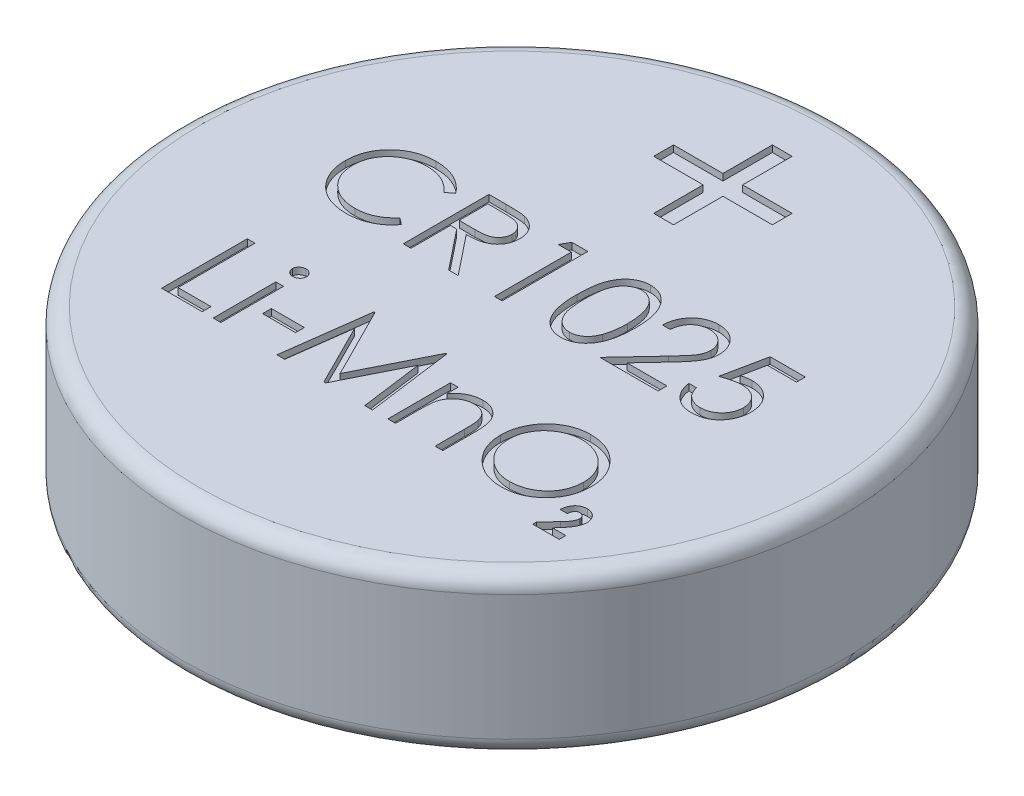
from build123d import *

# Parameters (mm, degrees)
BOSS_EXTRUDE1_START = 0.1
SKETCH1_R           = 5
BOSS_EXTRUDE1_DEPTH = 2.4
BOSS_EXTRUDE2_REACH = 9.5
SKETCH2_R           = 4
FILLET1_R           = 0.25
FILLET2_R           = 0.1
SKETCH3_W           = 0.116666667
SKETCH3_H           = 0.95
SKETCH3_W_2         = 0.5
SKETCH3_H_2         = 0.133333333
CUT_EXTRUDE1_DEPTH  = 0.1
CUT_EXTRUDE2_DEPTH  = 0.1


with BuildPart() as part:
    # Sketch1 → Boss-Extrude1 (new body)
    with BuildSketch(Plane(origin=(0, 0, 0), x_dir=(1, 0, 0), z_dir=(0, 1, 0)).offset(BOSS_EXTRUDE1_START)):
        with Locations(Location((0, 0, 0), (0, 0, 270))):
            Circle(SKETCH1_R)
    extrude(amount=BOSS_EXTRUDE1_DEPTH)

    # Sketch2 → Boss-Extrude2 (add, up to next)
    with BuildSketch(Plane.XZ, mode=Mode.PRIVATE) as boss_extrude2_sk1:
        with Locations(Location((0, 0, 0), (0, 0, 270))):
            Circle(SKETCH2_R)
    boss_extrude2_tool1 = extrude(boss_extrude2_sk1.sketch, amount=-BOSS_EXTRUDE2_REACH, mode=Mode.PRIVATE) - part.part
    add(boss_extrude2_tool1.solids().sort_by_distance((0, 0, 0))[0])

    # Fillet1
    fillet1_edges = [part.edges().sort_by_distance(p)[0] for p in [
        (0, 0.1, -5),
        (0, 2.5, -5),
    ]]
    fillet(fillet1_edges, radius=FILLET1_R)

    # Fillet2
    fillet2_edges = [part.edges().sort_by_distance(p)[0] for p in [
        (0, 0, 4),
    ]]
    fillet(fillet2_edges, radius=FILLET2_R - 0.0001)  # a hair under: the kernel refuses the full size

    # Sketch3 → Cut-Extrude1 (cut)
    # profile 1 of 14: a face of its own
    with BuildSketch(Plane(origin=(0, 2.5, 0), x_dir=(1, 0, 0), z_dir=(0, 1, 0))):
        with BuildLine():
            Line((-1.916666667, 1.061458333), (-2.01875, 0.983333333))
            add(Edge.make_bspline(
                [(-2.01875, 0.983333333), (-2.026032187, 0.992012122), (-2.040498382, 1.009252691), (-2.0637718, 1.033462236), (-2.088026696, 1.056143619), (-2.113253798, 1.077404888), (-2.139907185, 1.096502544), (-2.167341196, 1.114431811), (-2.196014756, 1.130502685), (-2.2356654, 1.149988937), (-2.287534601, 1.170323223), (-2.352829827, 1.187372995), (-2.420991092, 1.198226574), (-2.467493057, 1.199402087), (-2.491145833, 1.2)],
                knots=[0, 0, 0, 0, 0.757959112, 1.505699292, 2.245454638, 2.979532153, 3.711538275, 4.438200793, 5.171680507, 5.909471876, 7.393775596, 8.890124382, 10.418191784, 12, 12, 12, 12], degree=3))
            add(Edge.make_bspline(
                [(-2.491145833, 1.2), (-2.504176773, 1.199849957), (-2.530117713, 1.199551263), (-2.568615718, 1.195610731), (-2.606394851, 1.190072281), (-2.643430538, 1.181854304), (-2.679675637, 1.171464474), (-2.715367101, 1.15904932), (-2.749988181, 1.143688951), (-2.784017812, 1.126711598), (-2.816621519, 1.10753569), (-2.847470537, 1.086619302), (-2.876452353, 1.064196494), (-2.903589895, 1.040183226), (-2.928910905, 1.014687641), (-2.952231906, 0.987438028), (-2.973472201, 0.958521507), (-2.99305281, 0.928319384), (-3.010588968, 0.896919633), (-3.025271495, 0.864206035), (-3.038273397, 0.830738797), (-3.048561688, 0.796139794), (-3.05670508, 0.760652481), (-3.062323926, 0.724181617), (-3.066219644, 0.686803393), (-3.066516852, 0.661468506), (-3.066666667, 0.648697917)],
                knots=[0, 0, 0, 0, 1.054917814, 2.100044995, 3.131103042, 4.146048494, 5.169673617, 6.183595914, 7.203665975, 8.234915748, 9.262203917, 10.264457458, 11.251630812, 12.227803204, 13.197192746, 14.159520551, 15.12972552, 16.100847026, 17.073214652, 18.039054194, 19.002613845, 19.979014051, 20.95965708, 21.949030935, 22.966165397, 24, 24, 24, 24], degree=3))
            add(Edge.make_bspline(
                [(-3.066666667, 0.648697917), (-3.066197991, 0.629483426), (-3.065277809, 0.591758323), (-3.057088427, 0.536500668), (-3.044643679, 0.483564418), (-3.025992179, 0.433280476), (-3.002993675, 0.385028801), (-2.973932876, 0.339625798), (-2.940275305, 0.29638536), (-2.901544806, 0.256329408), (-2.859051218, 0.219738595), (-2.813459136, 0.187516951), (-2.764882115, 0.160657137), (-2.71385651, 0.138306071), (-2.659989667, 0.121125001), (-2.603378455, 0.109029755), (-2.544145999, 0.101139803), (-2.503671651, 0.100384433), (-2.483072917, 0.1)],
                knots=[0, 0, 0, 0, 1.029171465, 2.020641659, 2.987623507, 3.938342917, 4.889210282, 5.84687017, 6.821220943, 7.821438502, 8.827599549, 9.822697543, 10.807740252, 11.797342354, 12.80366471, 13.83203677, 14.896651826, 16, 16, 16, 16], degree=3))
            add(Edge.make_bspline(
                [(-2.483072917, 0.1), (-2.460377632, 0.100627261), (-2.415707883, 0.101861861), (-2.350199759, 0.112321011), (-2.287489332, 0.129279666), (-2.227573228, 0.15301318), (-2.17062036, 0.183866001), (-2.1165416, 0.22126807), (-2.065291303, 0.265575165), (-2.034473398, 0.299406041), (-2.01875, 0.316666667)],
                knots=[0, 0, 0, 0, 1.028121516, 2.023589091, 2.998037872, 3.967518031, 4.937445131, 5.927275754, 6.942489185, 8, 8, 8, 8], degree=3))
            Line((-2.01875, 0.316666667), (-1.916666667, 0.239322917))
            add(Edge.make_bspline(
                [(-1.916666667, 0.239322917), (-1.924881965, 0.22872292), (-1.94127321, 0.207573701), (-1.967814759, 0.177758494), (-1.995774898, 0.149714138), (-2.025361304, 0.123666736), (-2.056233627, 0.099095077), (-2.0889462, 0.076697254), (-2.123068984, 0.05616064), (-2.158486362, 0.037356354), (-2.195160704, 0.020672805), (-2.233048065, 0.006389977), (-2.271985136, -0.005913553), (-2.311973696, -0.016035701), (-2.353096692, -0.02393639), (-2.395205725, -0.029217983), (-2.438391679, -0.032836408), (-2.467527064, -0.033166206), (-2.482291667, -0.033333333)],
                knots=[0, 0, 0, 0, 0.986787822, 1.968848986, 2.935600012, 3.899624008, 4.868462664, 5.837806735, 6.815139263, 7.798259679, 8.787526145, 9.778297419, 10.776456485, 11.791383307, 12.812564526, 13.85620153, 14.913611965, 16, 16, 16, 16], degree=3))
            add(Edge.make_bspline(
                [(-2.482291667, -0.033333333), (-2.4962736, -0.033236022), (-2.523921142, -0.0330436), (-2.564740678, -0.02992651), (-2.604479666, -0.02567375), (-2.643024527, -0.019270273), (-2.680585603, -0.011713804), (-2.716822392, -0.00158448), (-2.75209147, 0.009762353), (-2.786251139, 0.023098491), (-2.819330456, 0.038147359), (-2.851222729, 0.055155652), (-2.88191329, 0.073980345), (-2.911703875, 0.094206492), (-2.940154406, 0.116483775), (-2.967511429, 0.140502811), (-2.993928349, 0.166182644), (-3.010272203, 0.184700161), (-3.018489583, 0.194010417)],
                knots=[0, 0, 0, 0, 1.114604814, 2.203992996, 3.262667896, 4.300477797, 5.318619304, 6.316056647, 7.298880507, 8.271930387, 9.238335007, 10.195173496, 11.151986948, 12.108099108, 13.064862484, 14.031167946, 15.010108607, 16, 16, 16, 16], degree=3))
            add(Edge.make_bspline(
                [(-3.018489583, 0.194010417), (-3.031651394, 0.210182858), (-3.057816114, 0.242332494), (-3.091291368, 0.294438715), (-3.119946174, 0.348841193), (-3.143114373, 0.405825738), (-3.161226245, 0.465264482), (-3.173773546, 0.527187387), (-3.181926999, 0.591536623), (-3.182859392, 0.635304573), (-3.183333333, 0.657552083)],
                knots=[0, 0, 0, 0, 0.994628077, 1.977248131, 2.950237994, 3.925870899, 4.908910175, 5.911660606, 6.938484602, 8, 8, 8, 8], degree=3))
            add(Edge.make_bspline(
                [(-3.183333333, 0.657552083), (-3.18275569, 0.680935538), (-3.181619213, 0.726941024), (-3.171963632, 0.794457064), (-3.156430936, 0.859141869), (-3.134369234, 0.920874688), (-3.106398675, 0.979980221), (-3.071845933, 1.036006954), (-3.031112423, 1.089313194), (-2.984517612, 1.139090102), (-2.933421173, 1.184604718), (-2.878702757, 1.224647023), (-2.820469462, 1.257970671), (-2.759362832, 1.285826389), (-2.694925293, 1.307237189), (-2.627294327, 1.322225516), (-2.556597016, 1.331554731), (-2.508362401, 1.332734093), (-2.483854167, 1.333333333)],
                knots=[0, 0, 0, 0, 1.032925535, 2.032216505, 3.007276963, 3.968222605, 4.92396291, 5.891752235, 6.871517503, 7.883894988, 8.900124299, 9.891468569, 10.874487609, 11.85992873, 12.854644235, 13.869047385, 14.917252991, 16, 16, 16, 16], degree=3))
            add(Edge.make_bspline(
                [(-2.483854167, 1.333333333), (-2.468917363, 1.333154253), (-2.439351464, 1.332799783), (-2.395614764, 1.329343216), (-2.353033329, 1.323581019), (-2.311577821, 1.315737907), (-2.271046564, 1.30600376), (-2.231749331, 1.293323077), (-2.193455533, 1.278823794), (-2.156406682, 1.262124935), (-2.120780534, 1.243380146), (-2.086588188, 1.2227972), (-2.05410124, 1.200401615), (-2.023091096, 1.176383864), (-1.994076504, 1.150235828), (-1.966233669, 1.122676721), (-1.940508125, 1.092912729), (-1.924628367, 1.071962325), (-1.916666667, 1.061458333)],
                knots=[0, 0, 0, 0, 1.096760587, 2.17092713, 3.219439832, 4.250915756, 5.268269357, 6.278326846, 7.281116186, 8.274029601, 9.260640565, 10.235837813, 11.203064059, 12.156899882, 13.114053108, 14.069676657, 15.032185724, 16, 16, 16, 16], degree=3))
        make_face()
    # profile 2 of 14: a face of its own
    with BuildSketch(Plane(origin=(0, 2.5, 0), x_dir=(1, 0, 0), z_dir=(0, 1, 0))):
        with BuildLine():
            Line((-1.65, 1.3), (-1.38984375, 1.3))
            add(Edge.make_bspline(
                [(-1.38984375, 1.3), (-1.372482759, 1.299942211), (-1.339147734, 1.299831249), (-1.291391948, 1.299212538), (-1.247999026, 1.297439205), (-1.208991658, 1.29591316), (-1.174370557, 1.293130439), (-1.144029563, 1.29047077), (-1.118108419, 1.286989125), (-1.102417102, 1.283755682), (-1.0953125, 1.282291667)],
                knots=[0, 0, 0, 0, 1.410062039, 2.707475311, 3.878576406, 4.937260626, 5.877586885, 6.699081471, 7.410979367, 8, 8, 8, 8], degree=3))
            add(Edge.make_bspline(
                [(-1.0953125, 1.282291667), (-1.085801468, 1.279941725), (-1.066982301, 1.275291973), (-1.039886562, 1.265464121), (-1.014066956, 1.254091118), (-0.989630735, 1.240733165), (-0.966700299, 1.225291104), (-0.945039212, 1.208031515), (-0.924549182, 1.189048839), (-0.906058863, 1.167864469), (-0.888624358, 1.14563948), (-0.873920011, 1.121606656), (-0.861244461, 1.096475231), (-0.851152555, 1.069989619), (-0.84302645, 1.042406675), (-0.837296704, 1.013476551), (-0.833860549, 0.983331046), (-0.833510717, 0.962769537), (-0.833333333, 0.95234375)],
                knots=[0, 0, 0, 0, 1.027469482, 2.033020251, 3.019912614, 3.986113645, 4.951240523, 5.91722682, 6.890402269, 7.87763091, 8.8651537, 9.85103654, 10.82876324, 11.815024772, 12.821070561, 13.842952187, 14.906261191, 16, 16, 16, 16], degree=3))
            add(Edge.make_bspline(
                [(-0.833333333, 0.95234375), (-0.833878961, 0.93502214), (-0.834943622, 0.901223192), (-0.84487009, 0.852172007), (-0.86112994, 0.806415976), (-0.883535733, 0.76401271), (-0.912068681, 0.725788756), (-0.946360746, 0.692215159), (-0.986431059, 0.664120334), (-1.023733376, 0.644637864), (-1.056684365, 0.632160498), (-1.083811024, 0.623381279), (-1.113401616, 0.616598263), (-1.145172626, 0.610521643), (-1.179256269, 0.60593387), (-1.215570855, 0.602573707), (-1.254142283, 0.600473632), (-1.280639651, 0.600160887), (-1.294270833, 0.6)],
                knots=[0, 0, 0, 0, 1.260483769, 2.459530307, 3.627416485, 4.787058657, 5.939039949, 7.08810263, 8.267026773, 9.491475466, 10.141966685, 10.831826277, 11.566392101, 12.351337768, 13.187381173, 14.07005841, 15.007169909, 16, 16, 16, 16], degree=3))
            Line((-1.294270833, 0.6), (-0.816666667, 0))
            Line((-0.816666667, 0), (-0.9609375, 0))
            Line((-0.9609375, 0), (-1.438541667, 0.6))
            Line((-1.438541667, 0.6), (-1.533333333, 0.6))
            Line((-1.533333333, 0.6), (-1.533333333, 0))
            Line((-1.533333333, 0), (-1.65, 0))
            Line((-1.65, 0), (-1.65, 1.3))
        make_face()
        with BuildLine():
            Line((-1.533333333, 1.166666667), (-1.533333333, 0.733333333))
            Line((-1.533333333, 0.733333333), (-1.2953125, 0.731510417))
            add(Edge.make_bspline(
                [(-1.2953125, 0.731510417), (-1.284199343, 0.7315055), (-1.262658879, 0.731495971), (-1.231495775, 0.732979373), (-1.202479733, 0.734666891), (-1.175721739, 0.737248077), (-1.15120984, 0.740574618), (-1.128956287, 0.744735726), (-1.108924753, 0.749583635), (-1.085562439, 0.757087096), (-1.059474584, 0.768975046), (-1.031122899, 0.786270803), (-1.006979174, 0.808025047), (-0.98658111, 0.832900902), (-0.970190179, 0.860251509), (-0.958634273, 0.889749017), (-0.951301366, 0.920648754), (-0.950436477, 0.941886337), (-0.95, 0.952604167)],
                knots=[0, 0, 0, 0, 1.146690395, 2.22261258, 3.21895312, 4.145990853, 4.996080663, 5.770904154, 6.481378293, 7.121626537, 8.300444488, 9.431385265, 10.535395872, 11.636531494, 12.74115979, 13.810798291, 14.895190096, 16, 16, 16, 16], degree=3))
            add(Edge.make_bspline(
                [(-0.95, 0.952604167), (-0.950446502, 0.963058608), (-0.951331306, 0.983775497), (-0.958555135, 1.014104835), (-0.970771191, 1.042729702), (-0.987233736, 1.069533654), (-1.007290565, 1.093864356), (-1.03080861, 1.11468187), (-1.057144825, 1.131860242), (-1.081759842, 1.142837584), (-1.103761121, 1.149567815), (-1.122863566, 1.154303961), (-1.144447829, 1.15810905), (-1.168618714, 1.161157758), (-1.195273034, 1.163778166), (-1.224545561, 1.165543112), (-1.25624208, 1.166588262), (-1.27821094, 1.166639924), (-1.289583333, 1.166666667)],
                knots=[0, 0, 0, 0, 1.101028733, 2.181837193, 3.264309656, 4.369019818, 5.486613113, 6.575447106, 7.666700264, 8.788928104, 9.402425223, 10.0903467, 10.862060571, 11.710948788, 12.657782767, 13.684531032, 14.801375019, 16, 16, 16, 16], degree=3))
            Line((-1.289583333, 1.166666667), (-1.533333333, 1.166666667))
        make_face(mode=Mode.SUBTRACT)
    # profile 3 of 14: a face of its own
    with BuildSketch(Plane(origin=(0, 2.5, 0), x_dir=(1, 0, 0), z_dir=(0, 1, 0))):
        Polygon((-0.390364583, 1.3), (-0.15, 1.3), (-0.15, 0), (-0.266666667, 0), (-0.266666667, 1.166666667), (-0.466666667, 1.166666667), align=None)
    # profile 4 of 14: a face of its own
    with BuildSketch(Plane(origin=(0, 2.5, 0), x_dir=(1, 0, 0), z_dir=(0, 1, 0))):
        with BuildLine():
            add(Edge.make_bspline(
                [(0.333333333, 0.649479167), (0.333455169, 0.670315339), (0.333691836, 0.710789905), (0.336324678, 0.769767058), (0.340698376, 0.825095165), (0.346692257, 0.876776875), (0.353986364, 0.924825531), (0.363723545, 0.969112726), (0.374796872, 1.009843437), (0.387630637, 1.047150484), (0.402111816, 1.081536488), (0.417873113, 1.113637277), (0.435540037, 1.14340428), (0.45410289, 1.171312602), (0.474313088, 1.196905403), (0.495595496, 1.220544106), (0.518780764, 1.241682385), (0.543080739, 1.260939583), (0.568715426, 1.277820816), (0.59495413, 1.292690118), (0.621977455, 1.305392926), (0.64985918, 1.315380802), (0.678348702, 1.323630546), (0.707545612, 1.329272155), (0.737498119, 1.332821864), (0.757715509, 1.333161226), (0.76796875, 1.333333333)],
                knots=[0, 0, 0, 0, 1.646270934, 3.197905019, 4.663502075, 6.030701355, 7.308322542, 8.50163776, 9.611534131, 10.641858119, 11.616356847, 12.558055219, 13.465016945, 14.349605745, 15.204443733, 16.039544428, 16.859896111, 17.680448484, 18.487036065, 19.28249412, 20.06191084, 20.843045899, 21.620316918, 22.403196591, 23.190181807, 24, 24, 24, 24], degree=3))
            add(Edge.make_bspline(
                [(0.76796875, 1.333333333), (0.778307642, 1.333152145), (0.798868445, 1.332791818), (0.829266299, 1.329328639), (0.858961895, 1.323582222), (0.887828632, 1.315440146), (0.916103627, 1.305338895), (0.943565722, 1.292677965), (0.970385495, 1.2779401), (0.996136744, 1.26062266), (1.021102173, 1.241314958), (1.044668559, 1.219488823), (1.066838048, 1.195364642), (1.087888876, 1.169200521), (1.107223812, 1.140494632), (1.125636801, 1.109746249), (1.142117843, 1.076417642), (1.157990722, 1.041064897), (1.171691603, 1.002709823), (1.184047637, 0.961568627), (1.194031254, 0.917155357), (1.202347269, 0.869703038), (1.208789659, 0.819037401), (1.213481784, 0.765267055), (1.215960358, 0.708356624), (1.216427133, 0.669446566), (1.216666667, 0.649479167)],
                knots=[0, 0, 0, 0, 0.810914788, 1.612654377, 2.396697861, 3.181598691, 3.963628158, 4.749916497, 5.551656086, 6.361998678, 7.18212741, 8.025565596, 8.878627764, 9.750805457, 10.657531673, 11.591944965, 12.560506719, 13.57287815, 14.630710178, 15.753379473, 16.941251878, 18.199788006, 19.531962791, 20.947069417, 22.433333509, 24, 24, 24, 24], degree=3))
            add(Edge.make_bspline(
                [(1.216666667, 0.649479167), (1.21642465, 0.629598858), (1.215953089, 0.590862887), (1.213509569, 0.534208525), (1.208696364, 0.480723538), (1.202675511, 0.430279651), (1.194336582, 0.383086822), (1.184083234, 0.338981741), (1.172698829, 0.297773943), (1.158645905, 0.259801013), (1.143264784, 0.22453323), (1.126529997, 0.191599718), (1.108601204, 0.16070938), (1.089068242, 0.132109474), (1.068248403, 0.105597402), (1.045696081, 0.081641142), (1.022047007, 0.059663464), (0.997008109, 0.040107145), (0.970855248, 0.022989932), (0.94412759, 0.00768193), (0.916350905, -0.004661642), (0.888154666, -0.015260372), (0.859135558, -0.023357682), (0.829329756, -0.028956543), (0.798888868, -0.03288323), (0.778311144, -0.033182779), (0.76796875, -0.033333333)],
                knots=[0, 0, 0, 0, 1.561518951, 3.042555995, 4.452378317, 5.7783523, 7.031515105, 8.214008947, 9.334062868, 10.386615937, 11.391082383, 12.354592575, 13.286541444, 14.194233754, 15.072674879, 15.931287219, 16.775624067, 17.606195743, 18.42308326, 19.229000347, 20.022332153, 20.807536673, 21.593273796, 22.3848459, 23.188221202, 24, 24, 24, 24], degree=3))
            add(Edge.make_bspline(
                [(0.76796875, -0.033333333), (0.757715793, -0.033160116), (0.737498964, -0.032818564), (0.707542349, -0.029284892), (0.678466013, -0.023603705), (0.650126476, -0.015648967), (0.622378341, -0.005912028), (0.595599721, 0.006773626), (0.569492867, 0.021383423), (0.544127432, 0.038021723), (0.519980058, 0.057084062), (0.496914861, 0.078167941), (0.475511283, 0.101799494), (0.455590047, 0.127605579), (0.436656815, 0.155348784), (0.419240762, 0.185407894), (0.403131587, 0.21766372), (0.388406862, 0.252324659), (0.375351644, 0.289896489), (0.363819638, 0.330809041), (0.35471438, 0.37542342), (0.346920711, 0.423381299), (0.340634511, 0.474888759), (0.336342905, 0.529973763), (0.333690416, 0.588601983), (0.333454533, 0.628816471), (0.333333333, 0.649479167)],
                knots=[0, 0, 0, 0, 0.810891512, 1.598919785, 2.382837074, 3.152667961, 3.926044502, 4.706494248, 5.493654104, 6.291793342, 7.103789334, 7.925228297, 8.761435821, 9.622817696, 10.50288917, 11.416980706, 12.369136599, 13.353924996, 14.394355917, 15.514179734, 16.714354668, 17.994756427, 19.357759367, 20.818452758, 22.365282078, 24, 24, 24, 24], degree=3))
        make_face()
        with BuildLine():
            add(Edge.make_bspline(
                [(0.45, 0.65), (0.450044366, 0.632636198), (0.450130472, 0.598936467), (0.452379918, 0.549966113), (0.45544429, 0.504291419), (0.459396771, 0.461854391), (0.465266438, 0.422798672), (0.471843245, 0.386855647), (0.479846821, 0.35421553), (0.489316399, 0.324654344), (0.500102349, 0.297670404), (0.511878813, 0.272561381), (0.524529939, 0.249030662), (0.53868848, 0.227289607), (0.554108361, 0.207267318), (0.570441286, 0.188609409), (0.588296817, 0.17197053), (0.612998207, 0.152014841), (0.645608326, 0.131393448), (0.686695924, 0.113436329), (0.728915634, 0.102151417), (0.757571813, 0.100716308), (0.771875, 0.1)],
                knots=[0, 0, 0, 0, 1.459021318, 2.831673884, 4.118529203, 5.306027144, 6.411944654, 7.436330062, 8.375795394, 9.233974572, 10.042671642, 10.816086306, 11.563610507, 12.285937304, 12.993564865, 13.685989202, 14.367179055, 15.041617293, 16.353048772, 17.594441528, 18.799311195, 20, 20, 20, 20], degree=3))
            add(Edge.make_bspline(
                [(0.771875, 0.1), (0.786270707, 0.100593461), (0.815032398, 0.101779159), (0.857053522, 0.11321869), (0.897847622, 0.130478805), (0.9298172, 0.150887878), (0.954139288, 0.170324115), (0.971565598, 0.18689527), (0.987560073, 0.205450306), (1.002729987, 0.225470045), (1.016643358, 0.247336968), (1.029295381, 0.270945924), (1.040840624, 0.296362476), (1.04741827, 0.314105522), (1.05078125, 0.323177083)],
                knots=[0, 0, 0, 0, 1.353760809, 2.704726607, 4.075137775, 5.516104923, 6.260822281, 7.007110065, 7.778089737, 8.566572457, 9.372053459, 10.217411131, 11.088608312, 12, 12, 12, 12], degree=3))
            add(Edge.make_bspline(
                [(1.05078125, 0.323177083), (1.054700478, 0.334776701), (1.062658192, 0.358328899), (1.072913994, 0.39486397), (1.080990856, 0.433196425), (1.088257249, 0.473097183), (1.093216956, 0.5148605), (1.097209001, 0.558357157), (1.099560399, 0.603619949), (1.099851878, 0.634372374), (1.1, 0.65)],
                knots=[0, 0, 0, 0, 0.884706709, 1.796334032, 2.740027952, 3.714592787, 4.726048262, 5.777819803, 6.87074269, 8, 8, 8, 8], degree=3))
            add(Edge.make_bspline(
                [(1.1, 0.65), (1.099795644, 0.665625098), (1.09939588, 0.696191131), (1.097867827, 0.740955027), (1.093921928, 0.783471624), (1.089539398, 0.823924085), (1.083077573, 0.862088483), (1.076110388, 0.898284311), (1.066749938, 0.932063148), (1.056751164, 0.96395385), (1.045307303, 0.993594093), (1.03271003, 1.021122071), (1.019256234, 1.046670683), (1.004643402, 1.070169833), (0.989045005, 1.091724777), (0.972049344, 1.110903341), (0.954330577, 1.128299929), (0.929512765, 1.148157455), (0.897022315, 1.168404656), (0.856593932, 1.187037653), (0.814521978, 1.197737876), (0.786080409, 1.199246502), (0.771875, 1.2)],
                knots=[0, 0, 0, 0, 1.31362396, 2.569729283, 3.763502607, 4.902122613, 5.988968491, 7.01645872, 7.998833611, 8.933434873, 9.825090667, 10.667526885, 11.477055099, 12.250526234, 12.991942729, 13.710640831, 14.402115721, 15.076753259, 16.378508321, 17.609869233, 18.806226677, 20, 20, 20, 20], degree=3))
            add(Edge.make_bspline(
                [(0.771875, 1.2), (0.75749678, 1.199245463), (0.728714147, 1.197735013), (0.686204906, 1.187077519), (0.645457576, 1.168501275), (0.613053042, 1.148090394), (0.588217921, 1.128650449), (0.570730064, 1.111792624), (0.554332914, 1.093352586), (0.539227768, 1.073146161), (0.52508032, 1.051430453), (0.512087373, 1.028034626), (0.500380936, 1.002840119), (0.489578108, 0.9758683), (0.480079644, 0.946309664), (0.472244744, 0.913709752), (0.465006695, 0.877881049), (0.459882738, 0.838613803), (0.455327629, 0.796166146), (0.452400271, 0.750377428), (0.450122947, 0.701324944), (0.450041803, 0.667450971), (0.45, 0.65)],
                knots=[0, 0, 0, 0, 1.207732386, 2.417664972, 3.655092373, 4.956220595, 5.625982001, 6.301752483, 6.994047911, 7.697131622, 8.419323945, 9.170223765, 9.943494443, 10.752040957, 11.610060368, 12.549350801, 13.567764191, 14.679664412, 15.874934091, 17.154273443, 18.533957287, 20, 20, 20, 20], degree=3))
        make_face(mode=Mode.SUBTRACT)
    # profile 5 of 14: a face of its own
    with BuildSketch(Plane(origin=(0, 2.5, 0), x_dir=(1, 0, 0), z_dir=(0, 1, 0))):
        with BuildLine():
            Line((1.5, 0.9), (1.383333333, 0.9))
            add(Edge.make_bspline(
                [(1.383333333, 0.9), (1.384093704, 0.915477758), (1.385587053, 0.945875664), (1.392580418, 0.990195972), (1.402587029, 1.032559183), (1.416735284, 1.072625151), (1.434306187, 1.110748136), (1.45537734, 1.146776714), (1.480335056, 1.180573441), (1.508640414, 1.211825011), (1.539383051, 1.24049468), (1.572553829, 1.265252342), (1.607410553, 1.286170334), (1.643847473, 1.303657653), (1.682275682, 1.316783881), (1.722346458, 1.326523347), (1.764235852, 1.332383133), (1.792776431, 1.333012996), (1.807291667, 1.333333333)],
                knots=[0, 0, 0, 0, 1.10065271, 2.161652631, 3.183658789, 4.190468796, 5.17591951, 6.163126047, 7.15150782, 8.156236427, 9.156009102, 10.134482811, 11.092018607, 12.041330605, 13.001268258, 13.972401359, 14.968799086, 16, 16, 16, 16], degree=3))
            add(Edge.make_bspline(
                [(1.807291667, 1.333333333), (1.82154638, 1.332999621), (1.849556382, 1.332343888), (1.890436559, 1.326712649), (1.92935384, 1.317892857), (1.966232153, 1.30551856), (2.000777263, 1.288884344), (2.033248679, 1.268902401), (2.06403298, 1.245792178), (2.091744072, 1.218583619), (2.11718993, 1.189537019), (2.139142196, 1.158527226), (2.157941371, 1.126499206), (2.17361108, 1.093208731), (2.185146218, 1.058342349), (2.193903838, 1.022407673), (2.19885402, 0.985032744), (2.199613749, 0.959736023), (2.2, 0.946875)],
                knots=[0, 0, 0, 0, 1.111607364, 2.184268762, 3.212621178, 4.221274766, 5.211760367, 6.196651075, 7.1921475, 8.207485113, 9.220403448, 10.201281604, 11.166441695, 12.114753415, 13.065576456, 14.026450734, 14.996634279, 16, 16, 16, 16], degree=3))
            add(Edge.make_bspline(
                [(2.2, 0.946875), (2.199371074, 0.928768661), (2.198124258, 0.892873725), (2.187458918, 0.840125347), (2.170801643, 0.78901922), (2.150745482, 0.747888222), (2.13051286, 0.714744353), (2.112280357, 0.687455977), (2.090936284, 0.658073946), (2.066169985, 0.626696649), (2.038493775, 0.593078313), (2.007656972, 0.557239246), (1.973439678, 0.519549732), (1.949423664, 0.493807651), (1.936979167, 0.48046875)],
                knots=[0, 0, 0, 0, 1.184426356, 2.348067706, 3.509069118, 4.696110526, 5.333549288, 6.050745305, 6.844228056, 7.710549037, 8.667450064, 9.695053472, 10.805634456, 12, 12, 12, 12], degree=3))
            Line((1.936979167, 0.48046875), (1.61171875, 0.133333333))
            Line((1.61171875, 0.133333333), (2.216666667, 0.133333333))
            Line((2.216666667, 0.133333333), (2.216666667, 0))
            Line((2.216666667, 0), (1.333333333, 0))
            Line((1.333333333, 0), (1.8375, 0.538020833))
            add(Edge.make_bspline(
                [(1.8375, 0.538020833), (1.849774929, 0.55083449), (1.873352557, 0.575446902), (1.906700371, 0.611380002), (1.936651995, 0.644715545), (1.963401312, 0.675390549), (1.986368043, 0.703853703), (2.006749158, 0.729183164), (2.023079234, 0.75249196), (2.040802096, 0.779509902), (2.057967289, 0.812497334), (2.072717592, 0.852809848), (2.081711679, 0.894308541), (2.082790618, 0.922352155), (2.083333333, 0.936458333)],
                knots=[0, 0, 0, 0, 1.329631726, 2.553950428, 3.673215718, 4.687767853, 5.603093632, 6.413772471, 7.123043292, 7.734684054, 8.834405432, 9.900288307, 10.943827018, 12, 12, 12, 12], degree=3))
            add(Edge.make_bspline(
                [(2.083333333, 0.936458333), (2.0830972, 0.945328567), (2.082631828, 0.962810094), (2.078524683, 0.988440805), (2.072317924, 1.013164879), (2.063423971, 1.037058366), (2.051684324, 1.059881036), (2.037394212, 1.081660672), (2.020906474, 1.102716573), (2.001833145, 1.122459227), (1.980880295, 1.140540817), (1.958745288, 1.156558335), (1.935326678, 1.16994429), (1.910723204, 1.180917589), (1.885003458, 1.189525588), (1.858117696, 1.195490203), (1.830140204, 1.199235126), (1.811036334, 1.199741818), (1.801302083, 1.2)],
                knots=[0, 0, 0, 0, 0.991446411, 1.95395049, 2.89581595, 3.838931463, 4.798493298, 5.75982156, 6.748411868, 7.785213223, 8.824556874, 9.840280684, 10.836137867, 11.835679398, 12.848801643, 13.863922112, 14.911575587, 16, 16, 16, 16], degree=3))
            add(Edge.make_bspline(
                [(1.801302083, 1.2), (1.791135774, 1.199734417), (1.771170821, 1.199212855), (1.741858037, 1.195564437), (1.713894749, 1.189270267), (1.687210613, 1.180661788), (1.661760481, 1.169720042), (1.637668122, 1.156091679), (1.61498762, 1.139829239), (1.59367634, 1.121391318), (1.574041148, 1.100863352), (1.556789451, 1.077979651), (1.541715389, 1.05315804), (1.528563388, 1.026465492), (1.517882703, 0.997659803), (1.509721247, 0.966843227), (1.503263276, 0.934149571), (1.501105825, 0.911572253), (1.5, 0.9)],
                knots=[0, 0, 0, 0, 1.031018746, 2.02475058, 2.990194455, 3.934040569, 4.864654155, 5.795059489, 6.735614925, 7.690564532, 8.649604399, 9.611025574, 10.590972636, 11.591080095, 12.624614302, 13.701020113, 14.821632451, 16, 16, 16, 16], degree=3))
        make_face()
    # profile 6 of 14: a face of its own
    with BuildSketch(Plane(origin=(0, 2.5, 0), x_dir=(1, 0, 0), z_dir=(0, 1, 0))):
        with BuildLine():
            Line((3.15, 1.3), (3.15, 1.166666667))
            Line((3.15, 1.166666667), (2.7078125, 1.166666667))
            Line((2.7078125, 1.166666667), (2.637760417, 0.824739583))
            add(Edge.make_bspline(
                [(2.637760417, 0.824739583), (2.651524027, 0.828539399), (2.678188846, 0.83590094), (2.717545365, 0.844074512), (2.754908184, 0.849001676), (2.779153321, 0.849674449), (2.790885417, 0.85)],
                knots=[0, 0, 0, 0, 1.100273476, 2.13160584, 3.095893838, 4, 4, 4, 4], degree=3))
            add(Edge.make_bspline(
                [(2.790885417, 0.85), (2.805402234, 0.849685795), (2.833945925, 0.84906799), (2.875708962, 0.843135589), (2.915575465, 0.833797907), (2.95346206, 0.820753141), (2.989438836, 0.804072383), (3.023174787, 0.783235263), (3.055176298, 0.758894311), (3.084869261, 0.730909021), (3.111806862, 0.700109563), (3.135491372, 0.666993783), (3.155608906, 0.631883508), (3.171788614, 0.594443282), (3.18470851, 0.555087025), (3.193307822, 0.513400637), (3.199034029, 0.46977705), (3.199673772, 0.439949638), (3.2, 0.424739583)],
                knots=[0, 0, 0, 0, 1.052922333, 2.070308379, 3.05430497, 4.020497103, 4.973039431, 5.925935799, 6.892292201, 7.88610001, 8.88166317, 9.857072816, 10.836096531, 11.812156883, 12.81219415, 13.836441305, 14.89672472, 16, 16, 16, 16], degree=3))
            add(Edge.make_bspline(
                [(3.2, 0.424739583), (3.199752972, 0.414145616), (3.199262254, 0.393100849), (3.196766779, 0.361847289), (3.191962085, 0.331255379), (3.185511216, 0.301321062), (3.177138317, 0.27210101), (3.167002383, 0.243511585), (3.154598144, 0.215730731), (3.140992205, 0.188495584), (3.125672085, 0.162421853), (3.108668639, 0.138037944), (3.090704314, 0.114978068), (3.071374656, 0.093489539), (3.050500001, 0.07371356), (3.028333156, 0.05553277), (3.005051003, 0.038639705), (2.980293342, 0.023720089), (2.954611848, 0.009990991), (2.927635653, -0.001272037), (2.899978822, -0.011341662), (2.871243296, -0.019368058), (2.841494166, -0.025657292), (2.810682392, -0.029928944), (2.778969572, -0.033040192), (2.757473139, -0.033234953), (2.746614583, -0.033333333)],
                knots=[0, 0, 0, 0, 1.056347294, 2.098418968, 3.122841568, 4.141288669, 5.149314143, 6.15115421, 7.162517403, 8.180376062, 9.185164535, 10.17417709, 11.141909838, 12.097768115, 13.052685741, 14.0056014, 14.954263652, 15.917497458, 16.885230207, 17.854509472, 18.828990115, 19.81800267, 20.826176721, 21.857883937, 22.917946725, 24, 24, 24, 24], degree=3))
            add(Edge.make_bspline(
                [(2.746614583, -0.033333333), (2.733661316, -0.033076736), (2.708177293, -0.032571912), (2.670841083, -0.02729076), (2.634918515, -0.01972702), (2.600698763, -0.008347834), (2.567875151, 0.005910304), (2.53688957, 0.023930596), (2.506950282, 0.044351406), (2.479274382, 0.068449823), (2.453587826, 0.094789933), (2.43059398, 0.1233742), (2.410115794, 0.15373085), (2.392481202, 0.186007307), (2.37743908, 0.220118762), (2.365622085, 0.256193019), (2.35608441, 0.294041592), (2.352049425, 0.32009861), (2.35, 0.333333333)],
                knots=[0, 0, 0, 0, 1.0467383, 2.05933395, 3.04377827, 4.011590433, 4.970194871, 5.932262533, 6.905835911, 7.896367577, 8.894135286, 9.877477877, 10.858688626, 11.851381753, 12.8477658, 13.868841284, 14.917554742, 16, 16, 16, 16], degree=3))
            Line((2.35, 0.333333333), (2.466666667, 0.333333333))
            add(Edge.make_bspline(
                [(2.466666667, 0.333333333), (2.469537274, 0.320936365), (2.47505474, 0.297108704), (2.487165446, 0.263631349), (2.501972772, 0.233798494), (2.519580101, 0.207215506), (2.540584398, 0.184035022), (2.564552472, 0.163377256), (2.591424483, 0.144740779), (2.621284826, 0.129206609), (2.652786826, 0.115958214), (2.685757504, 0.107136156), (2.719299119, 0.100932968), (2.741985371, 0.100312028), (2.753385417, 0.1)],
                knots=[0, 0, 0, 0, 1.136247022, 2.183929868, 3.172523383, 4.106158343, 5.02341133, 5.958108904, 6.928429099, 7.938127109, 8.96079061, 9.975095812, 10.982467395, 12, 12, 12, 12], degree=3))
            add(Edge.make_bspline(
                [(2.753385417, 0.1), (2.764512839, 0.10030486), (2.786422824, 0.100905133), (2.818667054, 0.105525337), (2.84979755, 0.112641007), (2.879507139, 0.12328981), (2.908315711, 0.136232134), (2.93549454, 0.152840591), (2.961829895, 0.171954312), (2.986503201, 0.193852489), (3.009100711, 0.21798409), (3.02906727, 0.243789979), (3.045698695, 0.271319093), (3.059714221, 0.300094836), (3.070356875, 0.330432585), (3.07794924, 0.362190165), (3.082407519, 0.395446014), (3.083020814, 0.418128901), (3.083333333, 0.4296875)],
                knots=[0, 0, 0, 0, 1.027316725, 2.022795036, 3.002884548, 3.971462791, 4.93288096, 5.914575861, 6.907176829, 7.935150275, 8.956128384, 9.956726525, 10.942570165, 11.921478529, 12.907843606, 13.90538589, 14.932640048, 16, 16, 16, 16], degree=3))
            add(Edge.make_bspline(
                [(3.083333333, 0.4296875), (3.083088755, 0.440115636), (3.082610028, 0.460527229), (3.078698674, 0.490389792), (3.071895227, 0.518645493), (3.062452071, 0.54543078), (3.05046254, 0.570770916), (3.035811053, 0.594692052), (3.018222648, 0.616878905), (2.998131375, 0.637341853), (2.976121245, 0.656227093), (2.951813569, 0.672326325), (2.925717025, 0.685870066), (2.898146031, 0.697558179), (2.868444783, 0.705952742), (2.837201462, 0.712255099), (2.804078685, 0.715900805), (2.78143243, 0.71640665), (2.769791667, 0.716666667)],
                knots=[0, 0, 0, 0, 1.045622112, 2.046656509, 3.013763289, 3.955457236, 4.890082067, 5.820317437, 6.762574623, 7.722996705, 8.69280354, 9.665887285, 10.63943826, 11.638615906, 12.663482002, 13.728887084, 14.832589034, 16, 16, 16, 16], degree=3))
            add(Edge.make_bspline(
                [(2.769791667, 0.716666667), (2.759715207, 0.716451019), (2.738909875, 0.71600576), (2.706995683, 0.712727347), (2.673458757, 0.707438466), (2.638427659, 0.700163574), (2.601797184, 0.69064346), (2.563644635, 0.679235217), (2.523889793, 0.665595617), (2.49710321, 0.655295081), (2.483333333, 0.65)],
                knots=[0, 0, 0, 0, 0.817624296, 1.688186739, 2.600797293, 3.572016777, 4.590301741, 5.671205678, 6.80286297, 8, 8, 8, 8], degree=3))
            Line((2.483333333, 0.65), (2.616666667, 1.3))
            Line((2.616666667, 1.3), (3.15, 1.3))
        make_face()
    # profile 7 of 14: a face of its own
    with BuildSketch(Plane(origin=(0, 2.5, 0), x_dir=(1, 0, 0), z_dir=(0, 1, 0))):
        Polygon((-2.9, -1.116666667), (-2.783333333, -1.116666667), (-2.783333333, -2.283333333), (-2.283333333, -2.283333333), (-2.283333333, -2.416666667), (-2.9, -2.416666667), align=None)
    # profile 8 of 14: a face of its own
    with BuildSketch(Plane(origin=(0, 2.5, 0), x_dir=(1, 0, 0), z_dir=(0, 1, 0))):
        with BuildLine():
            add(Edge.make_bspline(
                [(-2.058854167, -1.066666667), (-2.051614535, -1.067002495), (-2.037437946, -1.06766011), (-2.016937589, -1.073291516), (-1.998270699, -1.082837114), (-1.981713256, -1.095643852), (-1.967505412, -1.110705074), (-1.957558291, -1.128259148), (-1.951165115, -1.147223785), (-1.95039308, -1.160452247), (-1.95, -1.1671875)],
                knots=[0, 0, 0, 0, 1.055194115, 2.066272739, 3.074728998, 4.095836921, 5.109056067, 6.073838105, 7.019297344, 8, 8, 8, 8], degree=3))
            add(Edge.make_bspline(
                [(-1.95, -1.1671875), (-1.950401945, -1.173747914), (-1.951196543, -1.186717076), (-1.957553353, -1.205352937), (-1.967590184, -1.2226631), (-1.981704145, -1.237695078), (-1.998273113, -1.250494737), (-2.016936948, -1.260042211), (-2.037438115, -1.265673119), (-2.051614592, -1.266330804), (-2.058854167, -1.266666667)],
                knots=[0, 0, 0, 0, 0.96129708, 1.900370562, 2.859976407, 3.87933698, 4.906634145, 5.921202961, 6.938410037, 8, 8, 8, 8], degree=3))
            add(Edge.make_bspline(
                [(-2.058854167, -1.266666667), (-2.066010955, -1.266343628), (-2.079940707, -1.265714875), (-2.100134106, -1.259931725), (-2.11864183, -1.250491469), (-2.135231566, -1.237778886), (-2.149059923, -1.222570782), (-2.159125016, -1.205363501), (-2.165467144, -1.186714387), (-2.166263721, -1.173747011), (-2.166666667, -1.1671875)],
                knots=[0, 0, 0, 0, 1.054934014, 2.053291228, 3.073705704, 4.106921865, 5.123545215, 6.088680038, 7.033164197, 8, 8, 8, 8], degree=3))
            add(Edge.make_bspline(
                [(-2.166666667, -1.1671875), (-2.166272549, -1.160453184), (-2.165498476, -1.147226564), (-2.159120262, -1.128248409), (-2.149143762, -1.110798137), (-2.13522241, -1.095560094), (-2.118644267, -1.082840361), (-2.100133476, -1.073401996), (-2.079940874, -1.067618356), (-2.066011011, -1.066989671), (-2.058854167, -1.066666667)],
                knots=[0, 0, 0, 0, 0.98631895, 1.937192651, 2.907499808, 3.917963147, 4.944918757, 5.95915025, 6.951458133, 8, 8, 8, 8], degree=3))
        make_face()
    # profile 9 of 14: a face of its own
    with BuildSketch(Plane(origin=(0, 2.5, 0), x_dir=(1, 0, 0), z_dir=(0, 1, 0))):
        with Locations((-2.058333334, -1.941666667)):
            Rectangle(SKETCH3_W, SKETCH3_H)
    # profile 10 of 14: a face of its own
    with BuildSketch(Plane(origin=(0, 2.5, 0), x_dir=(1, 0, 0), z_dir=(0, 1, 0))):
        with Locations((-1.55, -1.916666667)):
            Rectangle(SKETCH3_W_2, SKETCH3_H_2)
    # profile 11 of 14: a face of its own
    with BuildSketch(Plane(origin=(0, 2.5, 0), x_dir=(1, 0, 0), z_dir=(0, 1, 0))):
        Polygon((-1.15, -2.416666667), (-0.978385417, -1.116666667), (-0.96171875, -1.116666667), (-0.425, -2.183333333), (0.110416667, -1.116666667), (0.12734375, -1.116666667), (0.3, -2.416666667), (0.1828125, -2.416666667), (0.058333333, -1.48125), (-0.4109375, -2.416666667), (-0.437239583, -2.416666667), (-0.908333333, -1.479166667), (-1.032552083, -2.416666667), align=None)
    # profile 12 of 14: a face of its own
    with BuildSketch(Plane(origin=(0, 2.5, 0), x_dir=(1, 0, 0), z_dir=(0, 1, 0))):
        with BuildLine():
            Line((0.533333333, -1.466666667), (0.65, -1.466666667))
            Line((0.65, -1.466666667), (0.65, -1.638020833))
            add(Edge.make_bspline(
                [(0.65, -1.638020833), (0.662456836, -1.622479251), (0.686629761, -1.592320267), (0.726886799, -1.552681196), (0.769431676, -1.520015827), (0.814003849, -1.493977275), (0.860663824, -1.474348528), (0.909127181, -1.460172611), (0.959684072, -1.451672532), (0.994065149, -1.450561875), (1.011458333, -1.45)],
                knots=[0, 0, 0, 0, 1.12780773, 2.188550248, 3.19190651, 4.159438251, 5.104880172, 6.052711206, 7.014878035, 8, 8, 8, 8], degree=3))
            add(Edge.make_bspline(
                [(1.011458333, -1.45), (1.029038283, -1.450648215), (1.063446485, -1.451916929), (1.113544051, -1.4619517), (1.160334169, -1.479091367), (1.203650004, -1.502570136), (1.242697254, -1.531766826), (1.276989342, -1.56578143), (1.305352834, -1.604906261), (1.324368997, -1.641203434), (1.336895667, -1.673402129), (1.344781963, -1.700979493), (1.351479185, -1.731703378), (1.357285263, -1.765480939), (1.361213904, -1.802548839), (1.36431247, -1.842755124), (1.366533128, -1.886086773), (1.366621233, -1.916056091), (1.366666667, -1.931510417)],
                knots=[0, 0, 0, 0, 1.235846778, 2.418850247, 3.575807741, 4.728682307, 5.871620074, 6.994088408, 8.11269785, 9.256955736, 9.865816715, 10.540099792, 11.271859618, 12.076849838, 12.949306005, 13.892391288, 14.913166135, 16, 16, 16, 16], degree=3))
            Line((1.366666667, -1.931510417), (1.366666667, -2.416666667))
            Line((1.366666667, -2.416666667), (1.25, -2.416666667))
            Line((1.25, -2.416666667), (1.25, -1.969791667))
            add(Edge.make_bspline(
                [(1.25, -1.969791667), (1.249928237, -1.956857616), (1.249790967, -1.932116977), (1.249358012, -1.896694197), (1.24831437, -1.864570611), (1.246847853, -1.835823017), (1.244701356, -1.810479021), (1.242464379, -1.788487004), (1.239728816, -1.769874888), (1.237291163, -1.758670715), (1.236197917, -1.753645833)],
                knots=[0, 0, 0, 0, 1.430800155, 2.736877192, 3.918605307, 4.986035426, 5.920637409, 6.731861385, 7.431261377, 8, 8, 8, 8], degree=3))
            add(Edge.make_bspline(
                [(1.236197917, -1.753645833), (1.232251291, -1.738895965), (1.224655257, -1.710507031), (1.205885492, -1.671999414), (1.182183082, -1.639240087), (1.153249595, -1.612431591), (1.119364509, -1.591568137), (1.080621856, -1.577092097), (1.037395504, -1.568038054), (1.006992448, -1.567136548), (0.991145833, -1.566666667)],
                knots=[0, 0, 0, 0, 1.084156227, 2.086665306, 3.027808233, 3.945421172, 4.874247719, 5.839848303, 6.874090471, 8, 8, 8, 8], degree=3))
            add(Edge.make_bspline(
                [(0.991145833, -1.566666667), (0.981760694, -1.566843468), (0.963187745, -1.567193354), (0.935646327, -1.570703837), (0.908931634, -1.576445549), (0.882775556, -1.584196757), (0.857701233, -1.594842743), (0.832903068, -1.60692508), (0.809314841, -1.621985845), (0.786433579, -1.638770933), (0.765145965, -1.657371781), (0.745338296, -1.676999742), (0.727681317, -1.697902109), (0.711684381, -1.719742089), (0.697875312, -1.742819629), (0.685821307, -1.766912086), (0.675593764, -1.79205117), (0.670511621, -1.80949905), (0.66796875, -1.818229167)],
                knots=[0, 0, 0, 0, 1.023777757, 2.026029729, 3.023749952, 4.003683103, 4.997618607, 5.993177895, 7.010360494, 8.046726602, 9.087585522, 10.09234134, 11.086953743, 12.070360549, 13.043493632, 14.017870808, 15.008233677, 16, 16, 16, 16], degree=3))
            add(Edge.make_bspline(
                [(0.66796875, -1.818229167), (0.666505452, -1.824638242), (0.663319929, -1.838590464), (0.659879319, -1.861486963), (0.656756505, -1.887973525), (0.654142778, -1.918019243), (0.652543623, -1.95172931), (0.65079999, -1.988959764), (0.650165196, -2.02985906), (0.650056607, -2.058333403), (0.65, -2.073177083)],
                knots=[0, 0, 0, 0, 0.615963638, 1.340920617, 2.168419149, 3.115676021, 4.16674242, 5.331190069, 6.6087489, 8, 8, 8, 8], degree=3))
            Line((0.65, -2.073177083), (0.65, -2.416666667))
            Line((0.65, -2.416666667), (0.533333333, -2.416666667))
            Line((0.533333333, -2.416666667), (0.533333333, -1.466666667))
        make_face()
    # profile 13 of 14: a face of its own
    with BuildSketch(Plane(origin=(0, 2.5, 0), x_dir=(1, 0, 0), z_dir=(0, 1, 0))):
        with BuildLine():
            add(Edge.make_bspline(
                [(2.275, -1.083333333), (2.299071582, -1.083943026), (2.346350156, -1.085140512), (2.415835118, -1.094307036), (2.482170439, -1.110165324), (2.54589649, -1.13128586), (2.606251024, -1.159460346), (2.663688327, -1.19351483), (2.718071738, -1.233806086), (2.768668251, -1.280022656), (2.814969404, -1.330307939), (2.855761876, -1.383971162), (2.889949013, -1.44068786), (2.918023734, -1.500287597), (2.940048932, -1.562635586), (2.955247434, -1.628064215), (2.96495589, -1.696149557), (2.966090893, -1.742588107), (2.966666667, -1.766145833)],
                knots=[0, 0, 0, 0, 1.065120563, 2.091984664, 3.0946048, 4.079830382, 5.057816894, 6.036188127, 7.030412546, 8.04752943, 9.064399622, 10.05169764, 11.02544977, 11.989514704, 12.962713494, 13.945757189, 14.957906945, 16, 16, 16, 16], degree=3))
            add(Edge.make_bspline(
                [(2.966666667, -1.766145833), (2.966090977, -1.789530028), (2.964956227, -1.835622984), (2.955236396, -1.903276263), (2.939992596, -1.96830995), (2.918228268, -2.030615479), (2.890287376, -2.090258574), (2.855872598, -2.147082299), (2.815334434, -2.201105285), (2.769200461, -2.251735703), (2.718908646, -2.298163335), (2.664965975, -2.338618917), (2.608585599, -2.373430735), (2.549041993, -2.401207528), (2.487124837, -2.423408527), (2.422279974, -2.438545218), (2.354811254, -2.448308977), (2.308802024, -2.44943014), (2.285416667, -2.45)],
                knots=[0, 0, 0, 0, 1.043624062, 2.057103931, 3.04512605, 4.022047818, 4.998200453, 5.980619268, 6.982898556, 8.009068085, 9.034988726, 10.034168286, 11.015286542, 11.987931943, 12.962482838, 13.94673481, 14.956375938, 16, 16, 16, 16], degree=3))
            add(Edge.make_bspline(
                [(2.285416667, -2.45), (2.261859062, -2.449424513), (2.215420754, -2.448290076), (2.147249855, -2.438565554), (2.081775264, -2.423358785), (2.01918422, -2.401626708), (1.959441817, -2.373540308), (1.902431215, -2.339292967), (1.848381246, -2.298656029), (1.797740026, -2.252537016), (1.751404609, -2.202330439), (1.71100827, -2.148534859), (1.676753228, -2.092205689), (1.648761133, -2.033186609), (1.626600048, -1.97176293), (1.611481115, -1.907524924), (1.60169919, -1.840838822), (1.600571962, -1.795434317), (1.6, -1.772395833)],
                knots=[0, 0, 0, 0, 1.053102029, 2.075944431, 3.073151272, 4.055350789, 5.033113405, 6.020478099, 7.024410459, 8.052272461, 9.079885166, 10.07527673, 11.055994387, 12.023226415, 12.992069828, 13.970394897, 14.97016774, 16, 16, 16, 16], degree=3))
            add(Edge.make_bspline(
                [(1.6, -1.772395833), (1.600198579, -1.756932271), (1.600593232, -1.726200225), (1.605344432, -1.680564059), (1.612238778, -1.635661815), (1.622119488, -1.591621177), (1.635042107, -1.548549954), (1.650290003, -1.506151099), (1.668913374, -1.464854287), (1.689966186, -1.424463885), (1.713463429, -1.38560952), (1.739417279, -1.348882817), (1.76691613, -1.31397559), (1.797062534, -1.281792417), (1.828862928, -1.251397059), (1.862833182, -1.223256621), (1.898766016, -1.197117354), (1.936816043, -1.173561227), (1.976045688, -1.152256406), (2.016485634, -1.133974004), (2.057586646, -1.11828261), (2.09954123, -1.105564589), (2.142237973, -1.095524118), (2.185770065, -1.088687101), (2.230102823, -1.083923783), (2.259969885, -1.083530997), (2.275, -1.083333333)],
                knots=[0, 0, 0, 0, 1.037015668, 2.060948919, 3.074880161, 4.083647147, 5.086022904, 6.090072063, 7.104153813, 8.122640571, 9.144368836, 10.147691507, 11.138137339, 12.123020368, 13.103399296, 14.087645067, 15.080126199, 16.082011238, 17.087798457, 18.072939717, 19.057185487, 20.037253025, 21.01195951, 21.997135196, 22.992090687, 24, 24, 24, 24], degree=3))
        make_face()
        with BuildLine():
            add(Edge.make_bspline(
                [(2.280729167, -1.216666667), (2.268392303, -1.216817054), (2.243836516, -1.217116392), (2.207330831, -1.221059372), (2.171305256, -1.226679045), (2.13575235, -1.234695039), (2.100820871, -1.245616544), (2.066185216, -1.258186024), (2.032161224, -1.273496715), (1.99886122, -1.290795148), (1.966578478, -1.30994189), (1.936116617, -1.331102832), (1.907396778, -1.353781724), (1.880489279, -1.378031492), (1.855473129, -1.40397563), (1.831855955, -1.43122082), (1.810584396, -1.460545809), (1.791089753, -1.491155388), (1.773644555, -1.52300969), (1.758131709, -1.555773353), (1.74544222, -1.589713637), (1.735093337, -1.624462324), (1.726513408, -1.65996438), (1.72107795, -1.696489124), (1.717091645, -1.733853023), (1.716809417, -1.759103426), (1.716666667, -1.771875)],
                knots=[0, 0, 0, 0, 1.008559885, 2.007477868, 2.99961109, 3.989939068, 4.984837346, 5.991145699, 7.001802488, 8.033829008, 9.059044045, 10.069351652, 11.065060232, 12.050310815, 13.029377138, 14.011219647, 14.996725999, 15.989392538, 16.977580475, 17.965360261, 18.951710183, 19.937753436, 20.929683414, 21.935841486, 22.955955122, 24, 24, 24, 24], degree=3))
            add(Edge.make_bspline(
                [(1.716666667, -1.771875), (1.717140187, -1.790655253), (1.718071747, -1.827601822), (1.726227416, -1.881744275), (1.738789864, -1.933777067), (1.757308314, -1.983415491), (1.780467114, -2.031086224), (1.809077102, -2.076366378), (1.842973334, -2.119268188), (1.881476929, -2.159492145), (1.92356822, -2.196206301), (1.968263234, -2.22843271), (2.015083146, -2.255699374), (2.06415005, -2.277912687), (2.115201993, -2.295514589), (2.16856794, -2.307578081), (2.223892397, -2.315517536), (2.261603783, -2.316279988), (2.280729167, -2.316666667)],
                knots=[0, 0, 0, 0, 1.032063989, 2.030389145, 3.003944642, 3.970395727, 4.937377036, 5.913328081, 6.909231446, 7.93887556, 8.970685674, 9.976071282, 10.964166581, 11.944589148, 12.933237628, 13.927779006, 14.949070134, 16, 16, 16, 16], degree=3))
            add(Edge.make_bspline(
                [(2.280729167, -2.316666667), (2.293584124, -2.316490051), (2.319079366, -2.316139768), (2.357000561, -2.312611688), (2.394238582, -2.306954137), (2.4307412, -2.298808465), (2.466466987, -2.288613788), (2.501565057, -2.276502346), (2.535661565, -2.261392185), (2.569186648, -2.244697232), (2.60127668, -2.225665173), (2.631910449, -2.205222432), (2.660315813, -2.182576944), (2.687203183, -2.158687471), (2.712322039, -2.133072327), (2.735502518, -2.105764816), (2.756666567, -2.076592572), (2.776153808, -2.046029422), (2.793537877, -2.014087956), (2.808684399, -1.981205504), (2.821534385, -1.947463035), (2.83190783, -1.91281188), (2.840036715, -1.877317851), (2.845637829, -1.840933422), (2.84955582, -1.80373138), (2.849851134, -1.778569376), (2.85, -1.765885417)],
                knots=[0, 0, 0, 0, 1.047197238, 2.076906641, 3.100256066, 4.114471768, 5.12198147, 6.126382909, 7.136867548, 8.15857795, 9.17633901, 10.174870724, 11.156907918, 12.133735059, 13.104061851, 14.077631395, 15.04955518, 16.038496417, 17.029181396, 18.010275684, 18.986308667, 19.968651475, 20.955262928, 21.950658345, 22.966943676, 24, 24, 24, 24], degree=3))
            add(Edge.make_bspline(
                [(2.85, -1.765885417), (2.849851015, -1.753288229), (2.849555476, -1.728299388), (2.8456397, -1.691356798), (2.840030798, -1.655234177), (2.831947506, -1.620073336), (2.821528878, -1.585865312), (2.808682155, -1.552642234), (2.79353333, -1.520280333), (2.776147418, -1.488859594), (2.756604398, -1.458708977), (2.735249393, -1.429885224), (2.711713692, -1.402929635), (2.68666974, -1.377176748), (2.659491983, -1.353175818), (2.630303531, -1.330918882), (2.599458736, -1.309868808), (2.566800049, -1.290879314), (2.533095151, -1.273342599), (2.498509967, -1.258317941), (2.463436301, -1.245551153), (2.427963345, -1.234661995), (2.391792525, -1.226710441), (2.355168246, -1.221054308), (2.318141178, -1.217117765), (2.293239411, -1.21681751), (2.280729167, -1.216666667)],
                knots=[0, 0, 0, 0, 1.02996197, 2.043119294, 3.035359645, 4.018872909, 4.991431989, 5.957985074, 6.929999688, 7.912076566, 8.892894881, 9.867085534, 10.843653904, 11.817741046, 12.803660682, 13.806313499, 14.818574707, 15.856120519, 16.894564902, 17.924820532, 18.937903209, 19.946497019, 20.957711757, 21.963978472, 22.977135795, 24, 24, 24, 24], degree=3))
        make_face(mode=Mode.SUBTRACT)
    # profile 14 of 14: a face of its own
    with BuildSketch(Plane(origin=(0, 2.5, 0), x_dir=(1, 0, 0), z_dir=(0, 1, 0))):
        with BuildLine():
            Line((3.138461538, -2.3), (3.030769231, -2.3))
            add(Edge.make_bspline(
                [(3.030769231, -2.3), (3.031234337, -2.291853647), (3.032143128, -2.275936161), (3.035758066, -2.252815504), (3.040601959, -2.230969026), (3.047066777, -2.210473147), (3.055190244, -2.191335316), (3.064763322, -2.173490291), (3.076030582, -2.157032025), (3.088752219, -2.142039891), (3.102712255, -2.128590309), (3.117620865, -2.116665064), (3.133706098, -2.106824653), (3.150674062, -2.098726905), (3.168521869, -2.092257181), (3.187418386, -2.087931647), (3.207199998, -2.085002353), (3.220742113, -2.084746028), (3.227644231, -2.084615385)],
                knots=[0, 0, 0, 0, 1.199038563, 2.342849363, 3.436047546, 4.486744587, 5.497670872, 6.488682221, 7.459191391, 8.424610317, 9.374430501, 10.305433194, 11.225809216, 12.140057399, 13.06607119, 14.010487599, 14.985989317, 16, 16, 16, 16], degree=3))
            add(Edge.make_bspline(
                [(3.227644231, -2.084615385), (3.236116483, -2.084879741), (3.252656304, -2.085395827), (3.276689976, -2.089798212), (3.299134798, -2.097161882), (3.319974455, -2.10745087), (3.339031534, -2.12052195), (3.356302876, -2.136107075), (3.371266169, -2.154533227), (3.384016282, -2.175033726), (3.394610103, -2.196740868), (3.402033811, -2.219186953), (3.406913335, -2.241776354), (3.407433766, -2.256986912), (3.407692308, -2.264543269)],
                knots=[0, 0, 0, 0, 1.075374347, 2.099382735, 3.09057751, 4.06680945, 5.040638231, 6.016817125, 7.011024321, 8.044445721, 9.0776792, 10.070479129, 11.0414456, 12, 12, 12, 12], degree=3))
            add(Edge.make_bspline(
                [(3.407692308, -2.264543269), (3.407591645, -2.269113888), (3.407389036, -2.278313414), (3.405980271, -2.292234555), (3.403866843, -2.306414865), (3.40068031, -2.320842185), (3.396706442, -2.33552056), (3.391885566, -2.350493917), (3.386105857, -2.365677362), (3.379463765, -2.381241783), (3.371539734, -2.397237711), (3.362313301, -2.413904932), (3.351539575, -2.431228659), (3.339348691, -2.449306709), (3.325681439, -2.46811057), (3.3104711, -2.487583599), (3.293892863, -2.507794412), (3.282126822, -2.521304206), (3.276081731, -2.528245192)],
                knots=[0, 0, 0, 0, 0.728284026, 1.46585585, 2.227944881, 3.01186502, 3.81876927, 4.650621989, 5.517437689, 6.406905708, 7.346299482, 8.360816762, 9.441613733, 10.596154504, 11.834900912, 13.145207542, 14.533280747, 16, 16, 16, 16], degree=3))
            Line((3.276081731, -2.528245192), (3.213461538, -2.6))
            Line((3.213461538, -2.6), (3.415384615, -2.6))
            Line((3.415384615, -2.6), (3.415384615, -2.7))
            Line((3.415384615, -2.7), (3.015384615, -2.7))
            Line((3.015384615, -2.7), (3.015384615, -2.645432692))
            Line((3.015384615, -2.645432692), (3.193028846, -2.456370192))
            add(Edge.make_bspline(
                [(3.193028846, -2.456370192), (3.198172103, -2.45085518), (3.208133067, -2.440174238), (3.222306491, -2.424488138), (3.235132188, -2.409602403), (3.246344207, -2.395358531), (3.256530939, -2.382218534), (3.26523816, -2.369786358), (3.272545533, -2.358174392), (3.280478722, -2.34417239), (3.288012644, -2.327472511), (3.294925474, -2.308233565), (3.299139322, -2.289845563), (3.299720966, -2.277863546), (3.3, -2.272115385)],
                knots=[0, 0, 0, 0, 1.246127091, 2.413378631, 3.493388633, 4.492180848, 5.408488754, 6.240484944, 6.999099869, 7.674939598, 8.898438119, 10.020720584, 11.050475521, 12, 12, 12, 12], degree=3))
            add(Edge.make_bspline(
                [(3.3, -2.272115385), (3.299791373, -2.266554482), (3.299387126, -2.25577934), (3.294944771, -2.240451759), (3.288062522, -2.226574199), (3.278364461, -2.214561337), (3.266617071, -2.204689572), (3.253041859, -2.19734723), (3.237749502, -2.193110733), (3.227029269, -2.192580475), (3.221514423, -2.192307692)],
                knots=[0, 0, 0, 0, 1.062038974, 2.057870785, 3.028805853, 4.01125022, 4.991535629, 5.949134679, 6.94496649, 8, 8, 8, 8], degree=3))
            add(Edge.make_bspline(
                [(3.221514423, -2.192307692), (3.218665384, -2.192408461), (3.213056592, -2.192606842), (3.204812106, -2.193927405), (3.196966886, -2.196254759), (3.189433609, -2.199373087), (3.182292673, -2.203506453), (3.17556209, -2.208601485), (3.169170943, -2.214528706), (3.163148546, -2.221269584), (3.157667379, -2.228792406), (3.152799026, -2.237028465), (3.148773709, -2.245972651), (3.145229673, -2.255506885), (3.142496343, -2.265733574), (3.14050614, -2.276591512), (3.138993121, -2.288063034), (3.138641956, -2.295948626), (3.138461538, -2.3)],
                knots=[0, 0, 0, 0, 0.903469896, 1.778625579, 2.63899355, 3.493148037, 4.358286772, 5.247621495, 6.164656832, 7.118446693, 8.109501108, 9.111810964, 10.146451449, 11.215617525, 12.33435995, 13.498009769, 14.714554818, 16, 16, 16, 16], degree=3))
        make_face()
    extrude(amount=-CUT_EXTRUDE1_DEPTH, mode=Mode.SUBTRACT)

    # Sketch4 → Cut-Extrude2 (cut)
    with BuildSketch(Plane(origin=(0, 2.5, 0), x_dir=(1, 0, 0), z_dir=(0, 1, 0))):
        Polygon((-0.9, 3.35), (-0.9, 3.05), (-0.15, 3.05), (-0.15, 2.3), (0.15, 2.3), (0.15, 3.05), (0.9, 3.05), (0.9, 3.35), (0.15, 3.35), (0.15, 4.1), (-0.15, 4.1), (-0.15, 3.35), align=None)
    extrude(amount=-CUT_EXTRUDE2_DEPTH, mode=Mode.SUBTRACT)


solid = part.part
